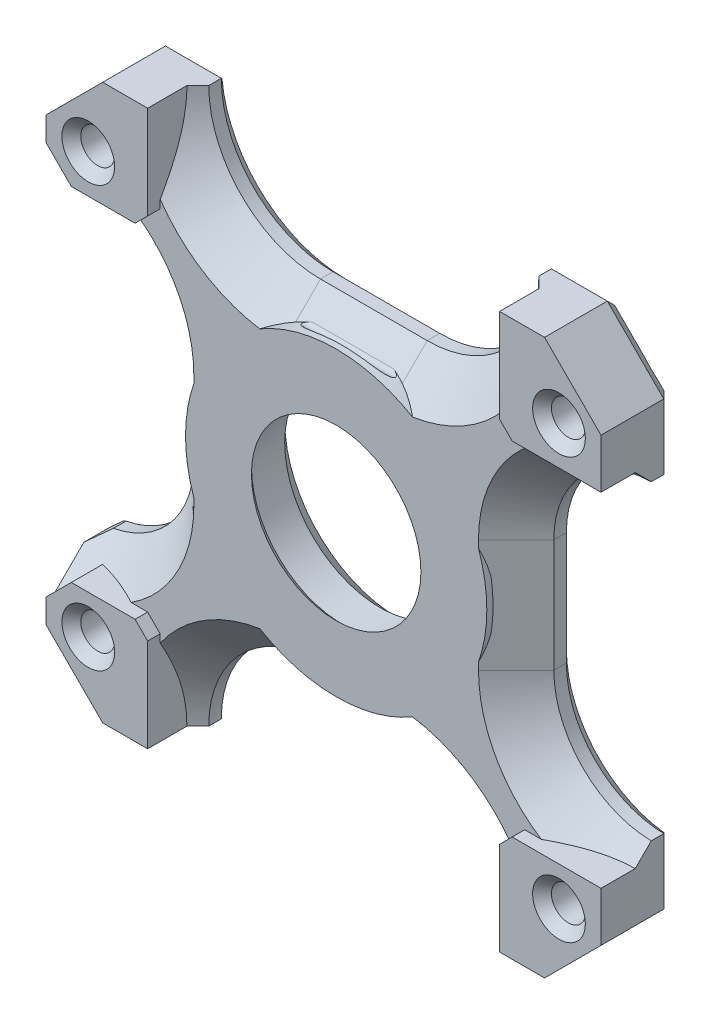
from build123d import *

# Parameters (mm, degrees)
CROQUIS1_W              = 44.2
CROQUIS1_H              = 44.2
CROQUIS1_R              = 7.6
SALIENTE_EXTRUIR1_DEPTH = 5
CHAFL_N2_SIZE           = 4.5
CROQUIS2_R              = 1.35
CORTAR_EXTRUIR1_DEPTH   = 32.651540247
CORTAR_EXTRUIR2_DEPTH   = 32.651540247
CHAFL_N4_SIZE           = 1
SALIENTE_EXTRUIR2_START = 1
CROQUIS4_R              = 1.35
SALIENTE_EXTRUIR2_DEPTH = 1
CHAFL_N5_SIZE           = 3
CHAFL_N3_SIZE           = 0.75
CROQUIS5_R              = 12
CROQUIS5_R_2            = 6.25
SALIENTE_EXTRUIR4_DEPTH = 0.5
CHAFL_N6_SIZE           = 1.5
CHAFL_N7_SIZE           = 1
CHAFL_N8_SIZE           = 2
CHAFL_N9_SIZE           = 1
REDONDEO2_R             = 0.5
CHAFL_N10_SIZE          = 1


with BuildPart() as part:
    # Croquis1 → Saliente-Extruir1 (new body)
    with BuildSketch(Plane.XY):
        Rectangle(CROQUIS1_W, CROQUIS1_H)
        Circle(CROQUIS1_R, mode=Mode.SUBTRACT)
    extrude(amount=SALIENTE_EXTRUIR1_DEPTH)

    # Chaflán2
    chafl_n2_edges = [part.edges().sort_by_distance(p)[0] for p in [
        (-22.1, 22.1, 2.5),
        (22.1, 22.1, 2.5),
        (22.1, -22.1, 2.5),
        (-22.1, -22.1, 2.5),
    ]]
    chamfer(chafl_n2_edges, length=CHAFL_N2_SIZE)

    # Croquis2 → Cortar-Extruir1 (cut, through all)
    with BuildSketch(Plane.XY.offset(5)):
        with Locations((-18.75, -16.75)):
            Circle(CROQUIS2_R)
        with Locations((18.75, -16.75)):
            Circle(CROQUIS2_R)
        with Locations((18.75, 16.75)):
            Circle(CROQUIS2_R)
        with Locations((-18.75, 16.75)):
            Circle(CROQUIS2_R)
    extrude(amount=-CORTAR_EXTRUIR1_DEPTH, mode=Mode.SUBTRACT)

    # Croquis3 → Cortar-Extruir2 (cut, through all)
    with BuildSketch(Plane.XY.offset(5)):
        with BuildLine():
            Line((-14.338204617, 4.5), (-14.338204617, -4.5))
            ThreePointArc((-14.338204617, -4.5), (-22.22621339, -12.388008773), (-30.114222163, -4.5))
            Line((-30.114222163, -4.5), (-30.114222163, 4.5))
            ThreePointArc((-30.114222163, 4.5), (-22.22621339, 12.388008773), (-14.338204617, 4.5))
        make_face()
        with BuildLine():
            Line((14.338204617, 4.5), (14.338204617, -4.5))
            ThreePointArc((14.338204617, -4.5), (22.22621339, -12.388008773), (30.114222163, -4.5))
            Line((30.114222163, -4.5), (30.114222163, 4.5))
            ThreePointArc((30.114222163, 4.5), (22.22621339, 12.388008773), (14.338204617, 4.5))
        make_face()
        with BuildLine():
            Line((-4.25, -13.19996993), (4.25, -13.19996993))
            ThreePointArc((4.25, -13.19996993), (13.15003007, -22.1), (4.25, -31.00003007))
            Line((4.25, -31.00003007), (-4.25, -31.00003007))
            ThreePointArc((-4.25, -31.00003007), (-13.15003007, -22.1), (-4.25, -13.19996993))
        make_face()
        with BuildLine():
            Line((-4.25, 13.19996993), (4.25, 13.19996993))
            ThreePointArc((4.25, 13.19996993), (13.15003007, 22.1), (4.25, 31.00003007))
            Line((4.25, 31.00003007), (-4.25, 31.00003007))
            ThreePointArc((-4.25, 31.00003007), (-13.15003007, 22.1), (-4.25, 13.19996993))
        make_face()
    extrude(amount=-CORTAR_EXTRUIR2_DEPTH, mode=Mode.SUBTRACT)

    # Chaflán4
    chafl_n4_edges = [part.edges().sort_by_distance(p)[0] for p in [
        (-10.543271615, 15.806728385, 0),
        (10.543271615, 15.806728385, 0),
        (0, 13.19996993, 0),
        (16.60410281, 10.032861379, 0),
        (16.60410281, -10.032861379, 0),
        (14.338204617, 0, 0),
        (-22.1, 14.99349948, 0),
        (15.375015035, 22.1, 0),
        (22.1, -14.99349948, 0),
        (-15.375015035, -22.1, 0),
        (19.85, -19.85, 0),
        (-19.85, -19.85, 0),
        (19.85, 19.85, 0),
        (-19.85, 19.85, 0),
        (-15.375015035, 22.1, 0),
        (22.1, 14.99349948, 0),
        (15.375015035, -22.1, 0),
        (-22.1, -14.99349948, 0),
        (-10.543271615, -15.806728385, 0),
        (10.543271615, -15.806728385, 0),
        (0, -13.19996993, 0),
        (-16.60410281, 10.032861379, 0),
        (-16.60410281, -10.032861379, 0),
        (-14.338204617, 0, 0),
    ]]
    chamfer(chafl_n4_edges, length=CHAFL_N4_SIZE)

    # Croquis4 → Saliente-Extruir2 (add)
    # profile 1 of 4: a face of its own
    with BuildSketch(Plane.XY.offset(5).offset(SALIENTE_EXTRUIR2_START)):
        Polygon((-22.1, -17.6), (-17.6, -22.1), (-14.019564426, -22.1), (-14.019564426, -13.660560818), (-22.1, -13.660560818), align=None)
        with Locations((-18.75, -16.75)):
            Circle(CROQUIS4_R, mode=Mode.SUBTRACT)
    # profile 2 of 4: a face of its own
    with BuildSketch(Plane.XY.offset(5).offset(SALIENTE_EXTRUIR2_START)):
        Polygon((22.1, -13.660560818), (22.1, -17.6), (17.6, -22.1), (14.019564426, -22.1), (14.019564426, -13.660560818), align=None)
        with Locations((18.75, -16.75)):
            Circle(CROQUIS4_R, mode=Mode.SUBTRACT)
    # profile 3 of 4: a face of its own
    with BuildSketch(Plane.XY.offset(5).offset(SALIENTE_EXTRUIR2_START)):
        Polygon((22.1, 17.6), (17.6, 22.1), (14.019564426, 22.1), (14.019564426, 13.660560818), (22.1, 13.660560818), align=None)
        with Locations((18.75, 16.75)):
            Circle(CROQUIS4_R, mode=Mode.SUBTRACT)
    # profile 4 of 4: a face of its own
    with BuildSketch(Plane.XY.offset(5).offset(SALIENTE_EXTRUIR2_START)):
        Polygon((-22.1, 13.660560818), (-22.1, 17.6), (-17.6, 22.1), (-14.019564426, 22.1), (-14.019564426, 13.660560818), align=None)
        with Locations((-18.75, 16.75)):
            Circle(CROQUIS4_R, mode=Mode.SUBTRACT)
    extrude(amount=-SALIENTE_EXTRUIR2_DEPTH)

    # Chaflán5
    chafl_n5_edges = [part.edges().sort_by_distance(p)[0] for p in [
        (-10.543271615, 15.806728385, 5),
        (0, 13.19996993, 5),
        (10.543271615, 15.806728385, 5),
        (14.338204617, 0, 5),
        (16.60410281, -10.032861379, 5),
        (-10.543271615, -15.806728385, 5),
        (10.543271615, -15.806728385, 5),
        (0, -13.19996993, 5),
        (-16.60410281, 10.032861379, 5),
        (-14.338204617, 0, 5),
    ]]
    chamfer(chafl_n5_edges, length=CHAFL_N5_SIZE)

    # Chaflán3
    # the kernel refuses this chamfer: 0.75 mm, written as the material it takes off along each edge
    with BuildSketch(Plane(origin=(-18.75, -16.75, 6), x_dir=(1, 0, 0), z_dir=(0, -1, 0))) as chafl_n3_piece_1:
        Polygon((1.35, -CHAFL_N3_SIZE), (1.35 + CHAFL_N3_SIZE, 0), (1.35, 0), align=None)
    revolve(axis=Axis((-18.75, -16.75, 6), (0, 0, 1)), mode=Mode.SUBTRACT)
    with BuildSketch(Plane(origin=(18.75, -16.75, 6), x_dir=(1, 0, 0), z_dir=(0, -1, 0))) as chafl_n3_piece_2:
        Polygon((1.35, -CHAFL_N3_SIZE), (1.35 + CHAFL_N3_SIZE, 0), (1.35, 0), align=None)
    revolve(axis=Axis((18.75, -16.75, 6), (0, 0, 1)), mode=Mode.SUBTRACT)
    with BuildSketch(Plane(origin=(18.75, 16.75, 6), x_dir=(1, 0, 0), z_dir=(0, -1, 0))) as chafl_n3_piece_3:
        Polygon((1.35 + CHAFL_N3_SIZE, 0), (1.35, -CHAFL_N3_SIZE), (1.35, 0), align=None)
    revolve(axis=Axis((18.75, 16.75, 6), (0, 0, 1)), mode=Mode.SUBTRACT)
    with BuildSketch(Plane(origin=(-18.75, 16.75, 6), x_dir=(1, 0, 0), z_dir=(0, -1, 0))) as chafl_n3_piece_4:
        Polygon((1.35, -CHAFL_N3_SIZE), (1.35 + CHAFL_N3_SIZE, 0), (1.35, 0), align=None)
    revolve(axis=Axis((-18.75, 16.75, 6), (0, 0, 1)), mode=Mode.SUBTRACT)
    with BuildSketch(Plane(origin=(-18.75, 16.75, 0), x_dir=(1, 0, 0), z_dir=(0, -1, 0))) as chafl_n3_piece_5:
        Polygon((1.35 + CHAFL_N3_SIZE, 0), (1.35, CHAFL_N3_SIZE), (1.35, 0), align=None)
    revolve(axis=Axis((-18.75, 16.75, 0), (0, 0, 1)), mode=Mode.SUBTRACT)
    with BuildSketch(Plane(origin=(18.75, 16.75, 0), x_dir=(1, 0, 0), z_dir=(0, -1, 0))) as chafl_n3_piece_6:
        Polygon((1.35 + CHAFL_N3_SIZE, 0), (1.35, CHAFL_N3_SIZE), (1.35, 0), align=None)
    revolve(axis=Axis((18.75, 16.75, 0), (0, 0, 1)), mode=Mode.SUBTRACT)
    with BuildSketch(Plane(origin=(18.75, -16.75, 0), x_dir=(1, 0, 0), z_dir=(0, -1, 0))) as chafl_n3_piece_7:
        Polygon((1.35 + CHAFL_N3_SIZE, 0), (1.35, CHAFL_N3_SIZE), (1.35, 0), align=None)
    revolve(axis=Axis((18.75, -16.75, 0), (0, 0, 1)), mode=Mode.SUBTRACT)
    with BuildSketch(Plane(origin=(-18.75, -16.75, 0), x_dir=(1, 0, 0), z_dir=(0, -1, 0))) as chafl_n3_piece_8:
        Polygon((1.35 + CHAFL_N3_SIZE, 0), (1.35, CHAFL_N3_SIZE), (1.35, 0), align=None)
    revolve(axis=Axis((-18.75, -16.75, 0), (0, 0, 1)), mode=Mode.SUBTRACT)

    # Croquis5 → Saliente-Extruir4 (add)
    with BuildSketch(Plane(origin=(0, 0, 5), x_dir=(-1, 0, 0), z_dir=(0, 0, -1))):
        Circle(CROQUIS5_R)
        Circle(CROQUIS5_R_2, mode=Mode.SUBTRACT)
    extrude(amount=SALIENTE_EXTRUIR4_DEPTH)

    # Chaflán6
    chafl_n6_edges = [part.edges().sort_by_distance(p)[0] for p in [
        (-7.6, 0, 0),
    ]]
    chamfer(chafl_n6_edges, length=CHAFL_N6_SIZE)

    # Chaflán7
    # the kernel refuses this chamfer: 1 mm, written as the material it takes off along each edge
    with BuildSketch(Plane(origin=(0, 0, 4.5), x_dir=(-1, 0, 0), z_dir=(0, -1, 0))) as chafl_n7_piece_1:
        Polygon((6.25 + CHAFL_N7_SIZE, 0), (6.25, -CHAFL_N7_SIZE), (6.25, 0), align=None)
    revolve(axis=Axis((0, 0, 4.5), (0, 0, -1)), mode=Mode.SUBTRACT)

    # Chaflán8
    chafl_n8_edges = [part.edges().sort_by_distance(p)[0] for p in [
        (-22.1, 13.660560818, 4.636710741),
        (-22.1, -13.660560818, 4.636710741),
    ]]
    chamfer(chafl_n8_edges, length=CHAFL_N8_SIZE)

    # Chaflán9
    # the kernel refuses this chamfer: 1.215079311, 1 mm, written as the material it takes off along each edge
    with BuildSketch(Plane(origin=(-22.1, 12.386998959, -2.515734332), x_dir=(0.9947326553644241, -0.10250338702521965, 0), z_dir=(0, 0, 1))) as chafl_n9_piece_1:
        with BuildLine():
            Line((1.365791053, 0), (-CHAFL_N9_SIZE * 0.102503387025, CHAFL_N9_SIZE * 0.994732655364))
            Line((-CHAFL_N9_SIZE * 0.102503387025, CHAFL_N9_SIZE * 0.994732655364), (0, 0))
            ThreePointArc((0, 0), (0.703125591, 0.029590114), (1.365791053, 0))
        make_face()
    extrude(amount=8.031468664, mode=Mode.SUBTRACT)
    with BuildSketch(Plane(origin=(-22.1, -12.386998959, -2.515734332), x_dir=(0, -1, 0), z_dir=(0, 0, 1))) as chafl_n9_piece_2:
        with BuildLine():
            Line((CHAFL_N9_SIZE, 0), (-0.139998209, 1.358596961))
            ThreePointArc((-0.139998209, 1.358596961), (-0.042638502, 0.702455073), (0, 0))
            Line((0, 0), (CHAFL_N9_SIZE, 0))
        make_face()
    extrude(amount=8.031468664, mode=Mode.SUBTRACT)

    # Redondeo2
    # the kernel refuses this fillet: 0.5 mm, written as the material it adds along each edge
    with BuildSketch(Plane(origin=(9.38020382, -10.69996993, 4.5), x_dir=(0, -1, 0), z_dir=(-1, 0, 0))) as redondeo2_piece_1_section:
        with BuildLine():
            CenterArc((REDONDEO2_R * 2.41421356237, -REDONDEO2_R), REDONDEO2_R, 90, 135)
            Line((REDONDEO2_R * 1.70710678119, -REDONDEO2_R * 1.70710678119), (0, 0))
            Line((0, 0), (REDONDEO2_R * 2.41421356237, 0))
        make_face()
    redondeo2_piece_1 = extrude(amount=18.76040764, mode=Mode.PRIVATE)
    redondeo2_piece_1 = redondeo2_piece_1 & Plane(origin=(0, 0, 4.5), x_dir=(-1, 0, 0), z_dir=(0, 0, 1)) * Cylinder(12, 43, mode=Mode.PRIVATE)
    add(redondeo2_piece_1)
    with BuildSketch(Plane(origin=(9.38020382, 10.69996993, 4.5), x_dir=(0, 1, 0), z_dir=(-1, 0, 0))) as redondeo2_piece_2_section:
        with BuildLine():
            CenterArc((REDONDEO2_R * 2.41421356237, REDONDEO2_R), REDONDEO2_R, 135, 135)
            Line((REDONDEO2_R * 1.70710678119, REDONDEO2_R * 1.70710678119), (0, 0))
            Line((0, 0), (REDONDEO2_R * 2.41421356237, 0))
        make_face()
    redondeo2_piece_2 = extrude(amount=18.76040764, mode=Mode.PRIVATE)
    redondeo2_piece_2 = redondeo2_piece_2 & Plane(origin=(0, 0, 4.5), x_dir=(-1, 0, 0), z_dir=(0, 0, 1)) * Cylinder(12, 43, mode=Mode.PRIVATE)
    add(redondeo2_piece_2)

    # Chaflán10
    chafl_n10_edges = [part.edges().sort_by_distance(p)[0] for p in [
        (-14.019564426, -13.660560818, 5.5),
        (14.019564426, -13.660560818, 5.5),
        (14.019564426, 13.660560818, 5.5),
        (-14.019564426, 13.660560818, 5.5),
    ]]
    chamfer(chafl_n10_edges, length=CHAFL_N10_SIZE)


solid = part.part
